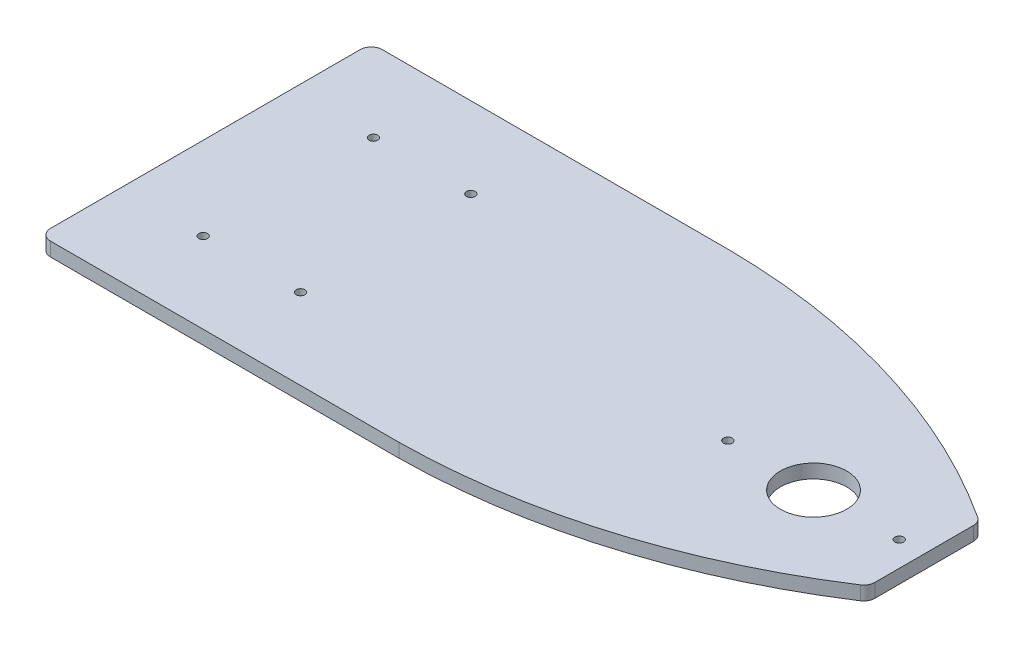
from build123d import *

# Parameters (mm, degrees)
SKETCH1_W           = 165.1
SKETCH1_H           = 76.2
BOSS_EXTRUDE1_DEPTH = 3.175
CUT_EXTRUDE1_DEPTH  = 3.175
FILLET3_R           = 2.54
SKETCH5_R           = 7.62
CUT_EXTRUDE2_DEPTH  = 3.175
SKETCH7_R           = 1.0033
CUT_EXTRUDE4_DEPTH  = 91.973584765
SKETCH6_R           = 1.0033
CUT_EXTRUDE5_DEPTH  = 91.973584765
FILLET4_R           = 2.54


with BuildPart() as part:
    # Sketch1 → Boss-Extrude1 (new body)
    with BuildSketch(Plane(origin=(0, 0, 0), x_dir=(1, 0, 0), z_dir=(0, 1, 0))):
        Rectangle(SKETCH1_W, SKETCH1_H)
    extrude(amount=BOSS_EXTRUDE1_DEPTH)

    # Sketch4 → Cut-Extrude1 (cut)
    with BuildSketch(Plane(origin=(0, 3.175, 0), x_dir=(1, 0, 0), z_dir=(0, 1, 0))):
        with BuildLine():
            Line((82.55, -38.1), (0, -38.1))
            ThreePointArc((0, -38.1), (43.112008449, -31.37027746), (82.55, -12.7))
            Line((82.55, -12.7), (82.55, -38.1))
        make_face()
        with BuildLine():
            Line((82.55, 38.1), (82.55, 12.7))
            ThreePointArc((82.55, 12.7), (43.112008449, 31.37027746), (0, 38.1))
            Line((0, 38.1), (82.55, 38.1))
        make_face()
    extrude(amount=-CUT_EXTRUDE1_DEPTH, mode=Mode.SUBTRACT)

    # Fillet3
    fillet3_edges = [part.edges().sort_by_distance(p)[0] for p in [
        (-82.55, 1.5875, 38.1),
        (-82.55, 1.5875, -38.1),
    ]]
    fillet(fillet3_edges, radius=FILLET3_R)

    # Sketch5 → Cut-Extrude2 (cut)
    with BuildSketch(Plane(origin=(0, 3.175, 0), x_dir=(1, 0, 0), z_dir=(0, 1, 0))):
        with Locations((57.15, 0)):
            Circle(SKETCH5_R)
    extrude(amount=-CUT_EXTRUDE2_DEPTH, mode=Mode.SUBTRACT)

    # Sketch7 → Cut-Extrude4 (cut, through all)
    with BuildSketch(Plane(origin=(0, 3.175, 0), x_dir=(1, 0, 0), z_dir=(0, 1, 0))):
        with Locations((76.835, 0)):
            Circle(SKETCH7_R)
        with Locations((37.465, 0)):
            Circle(SKETCH7_R)
    extrude(amount=-CUT_EXTRUDE4_DEPTH, mode=Mode.SUBTRACT)

    # Sketch6 → Cut-Extrude5 (cut, through all)
    with BuildSketch(Plane(origin=(0, 3.175, 0), x_dir=(1, 0, 0), z_dir=(0, 1, 0))):
        with Locations((-41.131290421, -19.558)):
            Circle(SKETCH6_R)
        with Locations((-63.5, -19.558)):
            Circle(SKETCH6_R)
        with Locations((-63.5, 19.558)):
            Circle(SKETCH6_R)
        with Locations((-41.131290421, 19.558)):
            Circle(SKETCH6_R)
    extrude(amount=-CUT_EXTRUDE5_DEPTH, mode=Mode.SUBTRACT)

    # Fillet4
    fillet4_edges = [part.edges().sort_by_distance(p)[0] for p in [
        (82.55, 1.5875, 12.7),
        (82.55, 1.5875, -12.7),
    ]]
    fillet(fillet4_edges, radius=FILLET4_R)


solid = part.part
